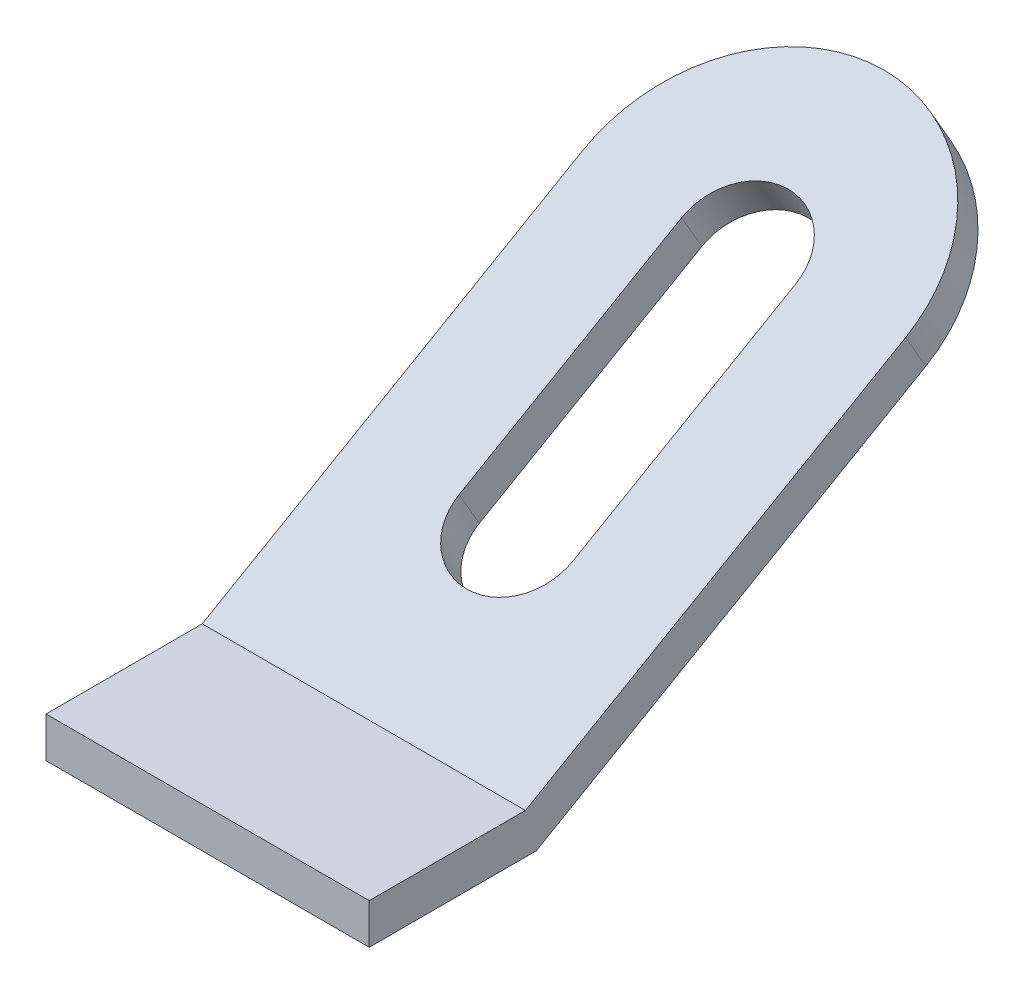
from build123d import *

# Parameters (mm, degrees)
SALIENTE_EXTRUIR3_DEPTH = 2
REDONDEO2_R             = 1
CORTAR_EXTRUIR1_REACH   = 6.346


with BuildPart() as part:
    # Croquis9 → Saliente-Extruir3 (new body)
    with BuildSketch(Plane(origin=(0, 0, 0), x_dir=(0, 0, -1), z_dir=(1, 0, 0))):
        Polygon((3.310095264, 1.766746825), (3.185095264, 1.983253175), (-0.033493649, 0.125), (-1, 0.125), (-1, -0.125), (0.033493649, -0.125), align=None)
    extrude(amount=SALIENTE_EXTRUIR3_DEPTH)

    # Redondeo2
    redondeo2_edges = [part.edges().sort_by_distance(p)[0] for p in [
        (0, 1.875, -3.247595264),
        (2, 1.875, -3.247595264),
    ]]
    fillet(redondeo2_edges, radius=REDONDEO2_R - 0.0001)  # a hair under: the kernel refuses the full size

    # Croquis10 → Cortar-Extruir1 (cut, up to next)
    with BuildSketch(Plane(origin=(0, 0.108253175, 0.0625), x_dir=(1, 0, 0), z_dir=(0, 0.8660254037844386, 0.4999999999999999)), mode=Mode.PRIVATE) as cortar_extruir1_sk1:
        with BuildLine():
            Line((0.646584864, 1.122348106), (0.646584864, 2.712399563))
            ThreePointArc((0.646584864, 2.712399563), (1, 3.065814699), (1.353415136, 2.712399563))
            Line((1.353415136, 2.712399563), (1.353415136, 1.122348106))
            ThreePointArc((1.353415136, 1.122348106), (1, 0.76893297), (0.646584864, 1.122348106))
        make_face()
    cortar_extruir1_tool1 = extrude(cortar_extruir1_sk1.sketch, amount=-CORTAR_EXTRUIR1_REACH, mode=Mode.PRIVATE) & part.part
    add(cortar_extruir1_tool1.solids().sort_by_distance((1, 1.06694, -1.597994))[0], mode=Mode.SUBTRACT)


solid = part.part
